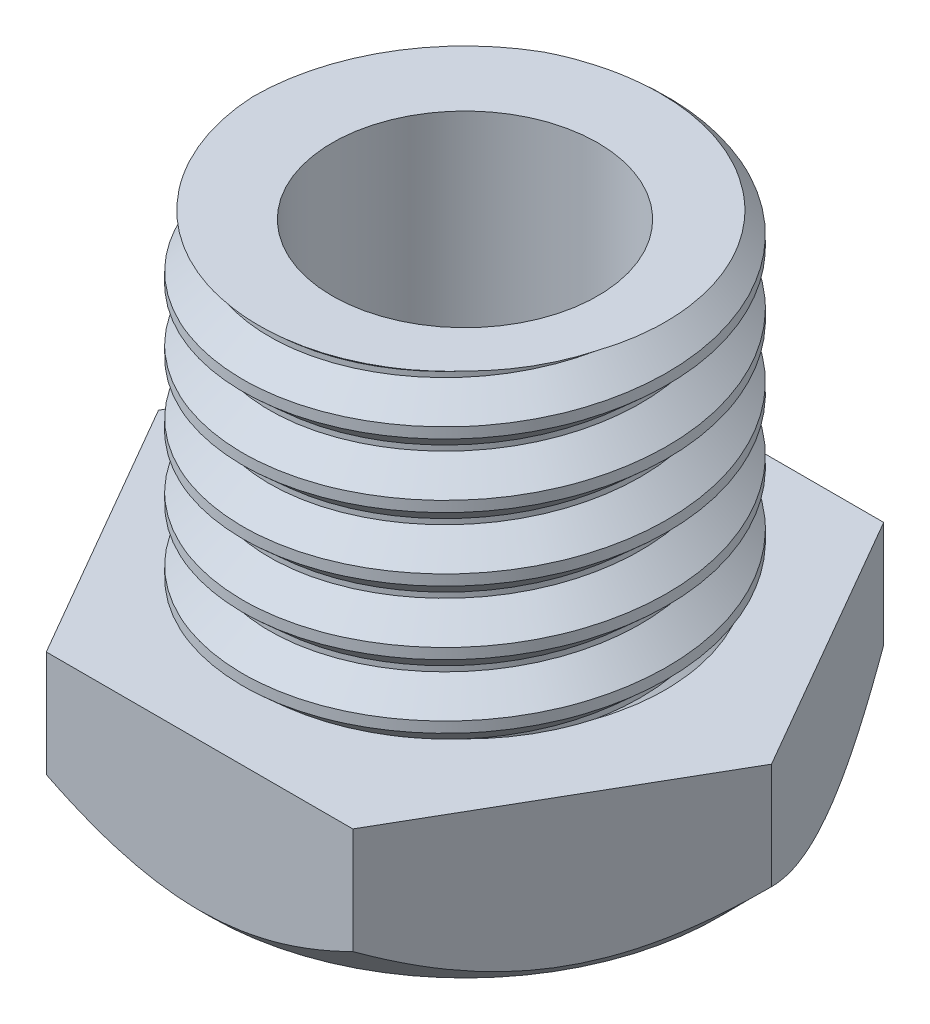
from build123d import *

# Parameters (mm, degrees)
SKETCH1_R           = 4
BOSS_EXTRUDE1_DEPTH = 3
SKETCH1_2_R         = 4
BOSS_EXTRUDE2_DEPTH = 9
CUT_SWEEP1_PITCH    = 1.2
CUT_SWEEP1_TO       = 6
SKETCH5_R           = 2.5
CUT_EXTRUDE1_DEPTH  = 10


with BuildPart() as part:
    # Sketch1 → Boss-Extrude1 (new body)
    with BuildSketch(Plane(origin=(0, 0, 0), x_dir=(1, 0, 0), z_dir=(0, 1, 0))):
        Polygon((5.773502692, 0), (2.886751346, 5), (-2.886751346, 5), (-5.773502692, 0), (-2.886751346, -5), (2.886751346, -5), align=None)
        with Locations(Location((0, 0, 0), (0, 0, 270))):
            Circle(SKETCH1_R, mode=Mode.SUBTRACT)
    extrude(amount=BOSS_EXTRUDE1_DEPTH)

    # Sketch1<2> → Boss-Extrude2 (add)
    with BuildSketch(Plane(origin=(0, 0, 0), x_dir=(1, 0, 0), z_dir=(0, 1, 0))):
        with Locations(Location((0, 0, 0), (0, 0, 270))):
            Circle(SKETCH1_2_R)
    extrude(amount=BOSS_EXTRUDE2_DEPTH)

    # Cut-Sweep1: arcs per turn and ends read off the stored shape
    # Cut-Sweep1: the profile of Sketch3 screwed along a right-hand helix through 6.5 turns, 8 arcs to a turn; built about Z, then put on its axis
    cut_sweep1_z = Axis((0, 0, 0), (0, 0, 1))
    cut_sweep1_corners = [(4, 0, -1.2), (3.5, 0, -0.75), (3.5, 0, -0.65), (4, 0, -0.2), (4.619941514, 0, -0.2), (4.619941514, 0, -1.2)]
    with BuildLine(mode=Mode.PRIVATE) as cut_sweep1_profile:
        Line(cut_sweep1_corners[0], cut_sweep1_corners[1])
        Line(cut_sweep1_corners[1], cut_sweep1_corners[2])
        Line(cut_sweep1_corners[2], cut_sweep1_corners[3])
        Line(cut_sweep1_corners[3], cut_sweep1_corners[4])
        Line(cut_sweep1_corners[4], cut_sweep1_corners[5])
        Line(cut_sweep1_corners[5], cut_sweep1_corners[0])
    cut_sweep1_cap = Face(cut_sweep1_profile.wire())
    cut_sweep1_turn_angles = [0, 22.5, 45, 67.5, 90, 112.5, 135, 157.5, 180, 202.5, 225, 247.5, 270, 292.5, 315, 337.5, 360]
    cut_sweep1_turn_weights = [1, 0.9238795325112867, 1, 0.9238795325112867, 1, 0.9238795325112867, 1, 0.9238795325112867, 1, 0.9238795325112867, 1, 0.9238795325112867, 1, 0.9238795325112867, 1, 0.9238795325112867, 1]
    cut_sweep1_turn_rails = [Edge.make_bspline([Vector(p[0], p[1], 0).rotate(cut_sweep1_z, cut_sweep1_turn_angles[k]) / cut_sweep1_turn_weights[k] + Vector(0, 0, p[2] + CUT_SWEEP1_PITCH * cut_sweep1_turn_angles[k] / 360) for k in range(17)], [0, 0, 0, 1, 1, 2, 2, 3, 3, 4, 4, 5, 5, 6, 6, 7, 7, 8, 8, 8], 2, cut_sweep1_turn_weights) for p in cut_sweep1_corners]
    cut_sweep1_turn_sides = [Face.make_surface_from_curves(cut_sweep1_turn_rails[p[0]], cut_sweep1_turn_rails[p[1]]) for p in [(0, 1), (1, 2), (2, 3), (3, 4), (4, 5), (5, 0)]]
    cut_sweep1_last_angles = [2160, 2182.5, 2205, 2227.5, 2250, 2272.5, 2295, 2317.5, 2340]
    cut_sweep1_last_weights = [1, 0.9238795325112867, 1, 0.9238795325112867, 1, 0.9238795325112867, 1, 0.9238795325112867, 1]
    cut_sweep1_last_rails = [Edge.make_bspline([Vector(p[0], p[1], 0).rotate(cut_sweep1_z, cut_sweep1_last_angles[k]) / cut_sweep1_last_weights[k] + Vector(0, 0, p[2] + CUT_SWEEP1_PITCH * cut_sweep1_last_angles[k] / 360) for k in range(9)], [0, 0, 0, 1, 1, 2, 2, 3, 3, 4, 4, 4], 2, cut_sweep1_last_weights) for p in cut_sweep1_corners]
    cut_sweep1_last_sides = [Face.make_surface_from_curves(cut_sweep1_last_rails[p[0]], cut_sweep1_last_rails[p[1]]) for p in [(0, 1), (1, 2), (2, 3), (3, 4), (4, 5), (5, 0)]]
    cut_sweep1 = Plane(origin=(0, 9, 0), x_dir=(-1, 0, 0), z_dir=(0, -1, 0)) * split(Solid(Shell([*[p.moved(Location((0, 0, CUT_SWEEP1_PITCH * i))) for i in range(6) for p in cut_sweep1_turn_sides], *cut_sweep1_last_sides, cut_sweep1_cap, cut_sweep1_cap.rotate(cut_sweep1_z, 2340).moved(Location((0, 0, CUT_SWEEP1_PITCH * 2340 / 360)))])), bisect_by=Plane.XY.offset(CUT_SWEEP1_TO), keep=Keep.BOTTOM, mode=Mode.PRIVATE)
    add(cut_sweep1, mode=Mode.SUBTRACT)

    # Sketch4 → Cut-Revolve1 (revolve, cut)
    with BuildSketch(Plane.XY, mode=Mode.PRIVATE) as cut_revolve1_sk:
        Polygon((-5.773502692, 0), (-5.773502692, 1), (-4.773502692, 0), align=None)
    revolve(cut_revolve1_sk.sketch.rotate(Axis((0, 9, 0), (0, -1, 0)), 270), axis=Axis((0, 9, 0), (0, -1, 0)), mode=Mode.SUBTRACT)

    # Sketch5 → Cut-Extrude1 (cut)
    with BuildSketch(Plane(origin=(0, 9, 0), x_dir=(1, 0, 0), z_dir=(0, 1, 0))):
        with Locations(Location((0, 0, 0), (0, 0, 270))):
            Circle(SKETCH5_R)
    extrude(amount=-CUT_EXTRUDE1_DEPTH, mode=Mode.SUBTRACT)


solid = part.part
